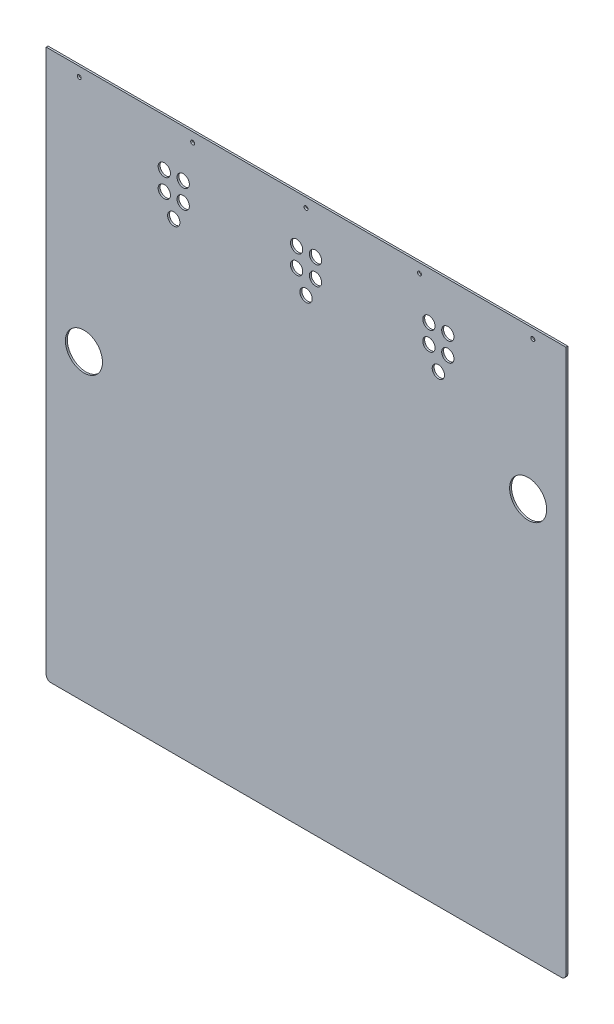
from build123d import *

# Parameters (mm, degrees)
SZKIC1_W                   = 550
SZKIC1_H                   = 580
ODGI_CIE_BAZOWE1_DEPTH     = 2
ZAOKR_GLENIE1_R            = 5
WYTNIJ_WYCI_GNI_CIE1_REACH = 401.661
SZKIC2_R                   = 19.6
WYTNIJ_WYCI_GNI_CIE3_REACH = 401.661
SZKIC4_R                   = 2.1
WYTNIJ_WYCI_GNI_CIE4_REACH = 401.661
SZKIC5_R                   = 6.5
WYTNIJ_WYCI_GNI_CIE5_REACH = 401.661
SZKIC6_R                   = 6.5


# Sheet-metal steps are written as plain solids
with BuildPart() as part:
    # Szkic1 → Odgięcie bazowe1 (new body)
    with BuildSketch(Plane.XY):
        Rectangle(SZKIC1_W, SZKIC1_H)
    extrude(amount=-ODGI_CIE_BAZOWE1_DEPTH)

    # Zaokrąglenie1
    zaokr_glenie1_edges = [part.edges().sort_by_distance(p)[0] for p in [
        (275, -290, -1),
        (-275, -290, -1),
    ]]
    fillet(zaokr_glenie1_edges, radius=ZAOKR_GLENIE1_R)

    # Szkic2 → Wytnij-wyciągnięcie1 (cut, up to next)
    with BuildSketch(Plane.XY, mode=Mode.PRIVATE) as wytnij_wyci_gni_cie1_sk1:
        with Locations((-235, 31)):
            Circle(SZKIC2_R)
    wytnij_wyci_gni_cie1_tool1 = extrude(wytnij_wyci_gni_cie1_sk1.sketch, amount=-WYTNIJ_WYCI_GNI_CIE1_REACH, mode=Mode.PRIVATE) & part.part
    # Szkic2 → Wytnij-wyciągnięcie1 (cut, up to next)
    with BuildSketch(Plane.XY, mode=Mode.PRIVATE) as wytnij_wyci_gni_cie1_sk2:
        with Locations((235, 131)):
            Circle(SZKIC2_R)
    wytnij_wyci_gni_cie1_tool2 = extrude(wytnij_wyci_gni_cie1_sk2.sketch, amount=-WYTNIJ_WYCI_GNI_CIE1_REACH, mode=Mode.PRIVATE) & part.part
    add(wytnij_wyci_gni_cie1_tool1.solids().sort_by_distance((-235, 31, 0))[0], mode=Mode.SUBTRACT)
    add(wytnij_wyci_gni_cie1_tool2.solids().sort_by_distance((235, 131, 0))[0], mode=Mode.SUBTRACT)

    # Szkic4 → Wytnij-wyciągnięcie3 (cut, up to next)
    with BuildSketch(Plane.XY, mode=Mode.PRIVATE) as wytnij_wyci_gni_cie3_sk1:
        with Locations((0, 280)):
            Circle(SZKIC4_R)
    wytnij_wyci_gni_cie3_tool1 = extrude(wytnij_wyci_gni_cie3_sk1.sketch, amount=-WYTNIJ_WYCI_GNI_CIE3_REACH, mode=Mode.PRIVATE) & part.part
    # Szkic4 → Wytnij-wyciągnięcie3 (cut, up to next)
    with BuildSketch(Plane.XY, mode=Mode.PRIVATE) as wytnij_wyci_gni_cie3_sk2:
        with Locations((120, 280)):
            Circle(SZKIC4_R)
    wytnij_wyci_gni_cie3_tool2 = extrude(wytnij_wyci_gni_cie3_sk2.sketch, amount=-WYTNIJ_WYCI_GNI_CIE3_REACH, mode=Mode.PRIVATE) & part.part
    # Szkic4 → Wytnij-wyciągnięcie3 (cut, up to next)
    with BuildSketch(Plane.XY, mode=Mode.PRIVATE) as wytnij_wyci_gni_cie3_sk3:
        with Locations((240, 280)):
            Circle(SZKIC4_R)
    wytnij_wyci_gni_cie3_tool3 = extrude(wytnij_wyci_gni_cie3_sk3.sketch, amount=-WYTNIJ_WYCI_GNI_CIE3_REACH, mode=Mode.PRIVATE) & part.part
    # Szkic4 → Wytnij-wyciągnięcie3 (cut, up to next)
    with BuildSketch(Plane.XY, mode=Mode.PRIVATE) as wytnij_wyci_gni_cie3_sk4:
        with Locations(Location((-240, 280, 0), (0, 0, 180))):
            Circle(SZKIC4_R)
    wytnij_wyci_gni_cie3_tool4 = extrude(wytnij_wyci_gni_cie3_sk4.sketch, amount=-WYTNIJ_WYCI_GNI_CIE3_REACH, mode=Mode.PRIVATE) & part.part
    # Szkic4 → Wytnij-wyciągnięcie3 (cut, up to next)
    with BuildSketch(Plane.XY, mode=Mode.PRIVATE) as wytnij_wyci_gni_cie3_sk5:
        with Locations(Location((-120, 280, 0), (0, 0, 180))):
            Circle(SZKIC4_R)
    wytnij_wyci_gni_cie3_tool5 = extrude(wytnij_wyci_gni_cie3_sk5.sketch, amount=-WYTNIJ_WYCI_GNI_CIE3_REACH, mode=Mode.PRIVATE) & part.part
    add(wytnij_wyci_gni_cie3_tool1.solids().sort_by_distance((0, 280, 0))[0], mode=Mode.SUBTRACT)
    add(wytnij_wyci_gni_cie3_tool2.solids().sort_by_distance((120, 280, 0))[0], mode=Mode.SUBTRACT)
    add(wytnij_wyci_gni_cie3_tool3.solids().sort_by_distance((240, 280, 0))[0], mode=Mode.SUBTRACT)
    add(wytnij_wyci_gni_cie3_tool4.solids().sort_by_distance((-240, 280, 0))[0], mode=Mode.SUBTRACT)
    add(wytnij_wyci_gni_cie3_tool5.solids().sort_by_distance((-120, 280, 0))[0], mode=Mode.SUBTRACT)

    # Szkic5 → Wytnij-wyciągnięcie4 (cut, up to next)
    with BuildSketch(Plane(origin=(0, 0, -2), x_dir=(-1, 0, 0), z_dir=(0, 0, -1)), mode=Mode.PRIVATE) as wytnij_wyci_gni_cie4_sk1:
        with Locations((-150, 240)):
            Circle(SZKIC5_R)
    wytnij_wyci_gni_cie4_tool1 = extrude(wytnij_wyci_gni_cie4_sk1.sketch, amount=-WYTNIJ_WYCI_GNI_CIE4_REACH, mode=Mode.PRIVATE) & part.part
    # Szkic5 → Wytnij-wyciągnięcie4 (cut, up to next)
    with BuildSketch(Plane(origin=(0, 0, -2), x_dir=(-1, 0, 0), z_dir=(0, 0, -1)), mode=Mode.PRIVATE) as wytnij_wyci_gni_cie4_sk2:
        with Locations((-130, 240)):
            Circle(SZKIC5_R)
    wytnij_wyci_gni_cie4_tool2 = extrude(wytnij_wyci_gni_cie4_sk2.sketch, amount=-WYTNIJ_WYCI_GNI_CIE4_REACH, mode=Mode.PRIVATE) & part.part
    # Szkic5 → Wytnij-wyciągnięcie4 (cut, up to next)
    with BuildSketch(Plane(origin=(0, 0, -2), x_dir=(-1, 0, 0), z_dir=(0, 0, -1)), mode=Mode.PRIVATE) as wytnij_wyci_gni_cie4_sk3:
        with Locations((-150, 220)):
            Circle(SZKIC5_R)
    wytnij_wyci_gni_cie4_tool3 = extrude(wytnij_wyci_gni_cie4_sk3.sketch, amount=-WYTNIJ_WYCI_GNI_CIE4_REACH, mode=Mode.PRIVATE) & part.part
    # Szkic5 → Wytnij-wyciągnięcie4 (cut, up to next)
    with BuildSketch(Plane(origin=(0, 0, -2), x_dir=(-1, 0, 0), z_dir=(0, 0, -1)), mode=Mode.PRIVATE) as wytnij_wyci_gni_cie4_sk4:
        with Locations((-130, 220)):
            Circle(SZKIC5_R)
    wytnij_wyci_gni_cie4_tool4 = extrude(wytnij_wyci_gni_cie4_sk4.sketch, amount=-WYTNIJ_WYCI_GNI_CIE4_REACH, mode=Mode.PRIVATE) & part.part
    # Szkic5 → Wytnij-wyciągnięcie4 (cut, up to next)
    with BuildSketch(Plane(origin=(0, 0, -2), x_dir=(-1, 0, 0), z_dir=(0, 0, -1)), mode=Mode.PRIVATE) as wytnij_wyci_gni_cie4_sk5:
        with Locations((10, 240)):
            Circle(SZKIC5_R)
    wytnij_wyci_gni_cie4_tool5 = extrude(wytnij_wyci_gni_cie4_sk5.sketch, amount=-WYTNIJ_WYCI_GNI_CIE4_REACH, mode=Mode.PRIVATE) & part.part
    # Szkic5 → Wytnij-wyciągnięcie4 (cut, up to next)
    with BuildSketch(Plane(origin=(0, 0, -2), x_dir=(-1, 0, 0), z_dir=(0, 0, -1)), mode=Mode.PRIVATE) as wytnij_wyci_gni_cie4_sk6:
        with Locations((10, 220)):
            Circle(SZKIC5_R)
    wytnij_wyci_gni_cie4_tool6 = extrude(wytnij_wyci_gni_cie4_sk6.sketch, amount=-WYTNIJ_WYCI_GNI_CIE4_REACH, mode=Mode.PRIVATE) & part.part
    # Szkic5 → Wytnij-wyciągnięcie4 (cut, up to next)
    with BuildSketch(Plane(origin=(0, 0, -2), x_dir=(-1, 0, 0), z_dir=(0, 0, -1)), mode=Mode.PRIVATE) as wytnij_wyci_gni_cie4_sk7:
        with Locations((-10, 220)):
            Circle(SZKIC5_R)
    wytnij_wyci_gni_cie4_tool7 = extrude(wytnij_wyci_gni_cie4_sk7.sketch, amount=-WYTNIJ_WYCI_GNI_CIE4_REACH, mode=Mode.PRIVATE) & part.part
    # Szkic5 → Wytnij-wyciągnięcie4 (cut, up to next)
    with BuildSketch(Plane(origin=(0, 0, -2), x_dir=(-1, 0, 0), z_dir=(0, 0, -1)), mode=Mode.PRIVATE) as wytnij_wyci_gni_cie4_sk8:
        with Locations((130, 220)):
            Circle(SZKIC5_R)
    wytnij_wyci_gni_cie4_tool8 = extrude(wytnij_wyci_gni_cie4_sk8.sketch, amount=-WYTNIJ_WYCI_GNI_CIE4_REACH, mode=Mode.PRIVATE) & part.part
    # Szkic5 → Wytnij-wyciągnięcie4 (cut, up to next)
    with BuildSketch(Plane(origin=(0, 0, -2), x_dir=(-1, 0, 0), z_dir=(0, 0, -1)), mode=Mode.PRIVATE) as wytnij_wyci_gni_cie4_sk9:
        with Locations((150, 220)):
            Circle(SZKIC5_R)
    wytnij_wyci_gni_cie4_tool9 = extrude(wytnij_wyci_gni_cie4_sk9.sketch, amount=-WYTNIJ_WYCI_GNI_CIE4_REACH, mode=Mode.PRIVATE) & part.part
    # Szkic5 → Wytnij-wyciągnięcie4 (cut, up to next)
    with BuildSketch(Plane(origin=(0, 0, -2), x_dir=(-1, 0, 0), z_dir=(0, 0, -1)), mode=Mode.PRIVATE) as wytnij_wyci_gni_cie4_sk10:
        with Locations((150, 240)):
            Circle(SZKIC5_R)
    wytnij_wyci_gni_cie4_tool10 = extrude(wytnij_wyci_gni_cie4_sk10.sketch, amount=-WYTNIJ_WYCI_GNI_CIE4_REACH, mode=Mode.PRIVATE) & part.part
    # Szkic5 → Wytnij-wyciągnięcie4 (cut, up to next)
    with BuildSketch(Plane(origin=(0, 0, -2), x_dir=(-1, 0, 0), z_dir=(0, 0, -1)), mode=Mode.PRIVATE) as wytnij_wyci_gni_cie4_sk11:
        with Locations((130, 240)):
            Circle(SZKIC5_R)
    wytnij_wyci_gni_cie4_tool11 = extrude(wytnij_wyci_gni_cie4_sk11.sketch, amount=-WYTNIJ_WYCI_GNI_CIE4_REACH, mode=Mode.PRIVATE) & part.part
    # Szkic5 → Wytnij-wyciągnięcie4 (cut, up to next)
    with BuildSketch(Plane(origin=(0, 0, -2), x_dir=(-1, 0, 0), z_dir=(0, 0, -1)), mode=Mode.PRIVATE) as wytnij_wyci_gni_cie4_sk12:
        with Locations((-10, 240)):
            Circle(SZKIC5_R)
    wytnij_wyci_gni_cie4_tool12 = extrude(wytnij_wyci_gni_cie4_sk12.sketch, amount=-WYTNIJ_WYCI_GNI_CIE4_REACH, mode=Mode.PRIVATE) & part.part
    add(wytnij_wyci_gni_cie4_tool1.solids().sort_by_distance((150, 240, -2))[0], mode=Mode.SUBTRACT)
    add(wytnij_wyci_gni_cie4_tool2.solids().sort_by_distance((130, 240, -2))[0], mode=Mode.SUBTRACT)
    add(wytnij_wyci_gni_cie4_tool3.solids().sort_by_distance((150, 220, -2))[0], mode=Mode.SUBTRACT)
    add(wytnij_wyci_gni_cie4_tool4.solids().sort_by_distance((130, 220, -2))[0], mode=Mode.SUBTRACT)
    add(wytnij_wyci_gni_cie4_tool5.solids().sort_by_distance((-10, 240, -2))[0], mode=Mode.SUBTRACT)
    add(wytnij_wyci_gni_cie4_tool6.solids().sort_by_distance((-10, 220, -2))[0], mode=Mode.SUBTRACT)
    add(wytnij_wyci_gni_cie4_tool7.solids().sort_by_distance((10, 220, -2))[0], mode=Mode.SUBTRACT)
    add(wytnij_wyci_gni_cie4_tool8.solids().sort_by_distance((-130, 220, -2))[0], mode=Mode.SUBTRACT)
    add(wytnij_wyci_gni_cie4_tool9.solids().sort_by_distance((-150, 220, -2))[0], mode=Mode.SUBTRACT)
    add(wytnij_wyci_gni_cie4_tool10.solids().sort_by_distance((-150, 240, -2))[0], mode=Mode.SUBTRACT)
    add(wytnij_wyci_gni_cie4_tool11.solids().sort_by_distance((-130, 240, -2))[0], mode=Mode.SUBTRACT)
    add(wytnij_wyci_gni_cie4_tool12.solids().sort_by_distance((10, 240, -2))[0], mode=Mode.SUBTRACT)

    # Szkic6 → Wytnij-wyciągnięcie5 (cut, up to next)
    with BuildSketch(Plane(origin=(0, 0, -2), x_dir=(-1, 0, 0), z_dir=(0, 0, -1)), mode=Mode.PRIVATE) as wytnij_wyci_gni_cie5_sk1:
        with Locations((0, 200)):
            Circle(SZKIC6_R)
    wytnij_wyci_gni_cie5_tool1 = extrude(wytnij_wyci_gni_cie5_sk1.sketch, amount=-WYTNIJ_WYCI_GNI_CIE5_REACH, mode=Mode.PRIVATE) & part.part
    # Szkic6 → Wytnij-wyciągnięcie5 (cut, up to next)
    with BuildSketch(Plane(origin=(0, 0, -2), x_dir=(-1, 0, 0), z_dir=(0, 0, -1)), mode=Mode.PRIVATE) as wytnij_wyci_gni_cie5_sk2:
        with Locations((140, 200)):
            Circle(SZKIC6_R)
    wytnij_wyci_gni_cie5_tool2 = extrude(wytnij_wyci_gni_cie5_sk2.sketch, amount=-WYTNIJ_WYCI_GNI_CIE5_REACH, mode=Mode.PRIVATE) & part.part
    # Szkic6 → Wytnij-wyciągnięcie5 (cut, up to next)
    with BuildSketch(Plane(origin=(0, 0, -2), x_dir=(-1, 0, 0), z_dir=(0, 0, -1)), mode=Mode.PRIVATE) as wytnij_wyci_gni_cie5_sk3:
        with Locations((-140, 200)):
            Circle(SZKIC6_R)
    wytnij_wyci_gni_cie5_tool3 = extrude(wytnij_wyci_gni_cie5_sk3.sketch, amount=-WYTNIJ_WYCI_GNI_CIE5_REACH, mode=Mode.PRIVATE) & part.part
    add(wytnij_wyci_gni_cie5_tool1.solids().sort_by_distance((0, 200, -2))[0], mode=Mode.SUBTRACT)
    add(wytnij_wyci_gni_cie5_tool2.solids().sort_by_distance((-140, 200, -2))[0], mode=Mode.SUBTRACT)
    add(wytnij_wyci_gni_cie5_tool3.solids().sort_by_distance((140, 200, -2))[0], mode=Mode.SUBTRACT)


solid = part.part
